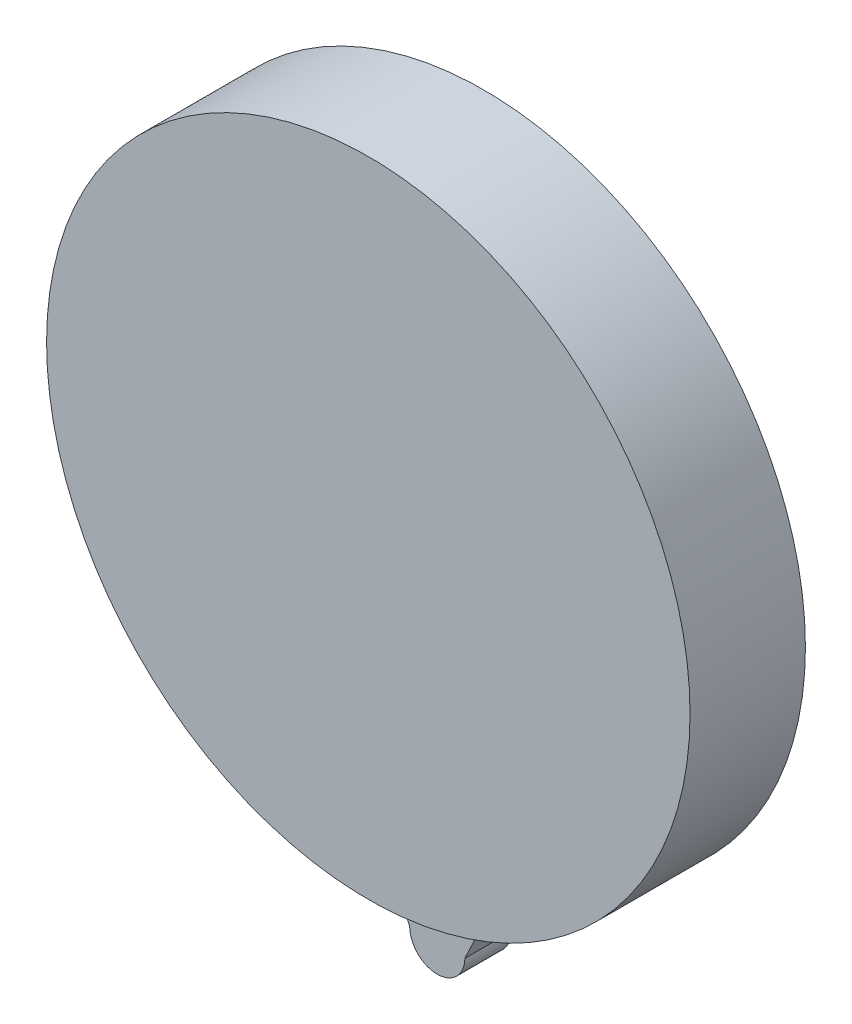
from build123d import *

# Parameters (mm, degrees)
SKETCH1_R           = 70
BOSS_EXTRUDE1_DEPTH = 25
BOSS_EXTRUDE2_DEPTH = 10
BOSS_EXTRUDE3_START = 0.1
SKETCH27_R          = 70
BOSS_EXTRUDE3_DEPTH = 0.1
SHELL3_START        = -0.1
SHELL3_OUTLINE_R    = 68
SHELL3_DEPTH        = 23.1
SHELL3_START_2      = 2
SHELL3_2_DEPTH      = 6


# Read off the part's stored shape, not the designer's step: Shell3
with BuildPart() as part:
    # Sketch1 → Boss-Extrude1 (new body)
    with BuildSketch(Plane.XY):
        Circle(SKETCH1_R)
    extrude(amount=BOSS_EXTRUDE1_DEPTH)

    # Sketch21 → Boss-Extrude2 (add)
    with BuildSketch(Plane.XY):
        with BuildLine():
            Line((-13.97898065, -68.59), (-6, -85.59))
            ThreePointArc((-6, -85.59), (0, -91.59), (6, -85.59))
            Line((6, -85.59), (13.97898065, -68.59))
            ThreePointArc((13.97898065, -68.59), (0, -70), (-13.97898065, -68.59))
        make_face()
    extrude(amount=BOSS_EXTRUDE2_DEPTH)

    # Sketch27 → Boss-Extrude3 (add)
    with BuildSketch(Plane(origin=(0, 0, 0), x_dir=(-1, 0, 0), z_dir=(0, 0, -1)).offset(BOSS_EXTRUDE3_START)):
        Circle(SKETCH27_R)
    extrude(amount=-BOSS_EXTRUDE3_DEPTH)

    # Shell3 outline → Shell3 (cut)
    with BuildSketch(Plane.XY.offset(SHELL3_START)):
        Circle(SHELL3_OUTLINE_R)
    extrude(amount=SHELL3_DEPTH, mode=Mode.SUBTRACT)

    # Shell3 2 outline → Shell3 2 (cut)
    with BuildSketch(Plane.XY.offset(SHELL3_START_2)):
        with BuildLine():
            ThreePointArc((12.599173957, -66.82260707), (0, -68), (-12.599173957, -66.82260707))
            Line((-12.599173957, -66.82260707), (-3.979676533, -85.187290811))
            ThreePointArc((-3.979676533, -85.187290811), (0, -89.59), (3.979676533, -85.187290811))
            Line((3.979676533, -85.187290811), (12.599173957, -66.82260707))
        make_face()
    extrude(amount=SHELL3_2_DEPTH, mode=Mode.SUBTRACT)


solid = part.part
